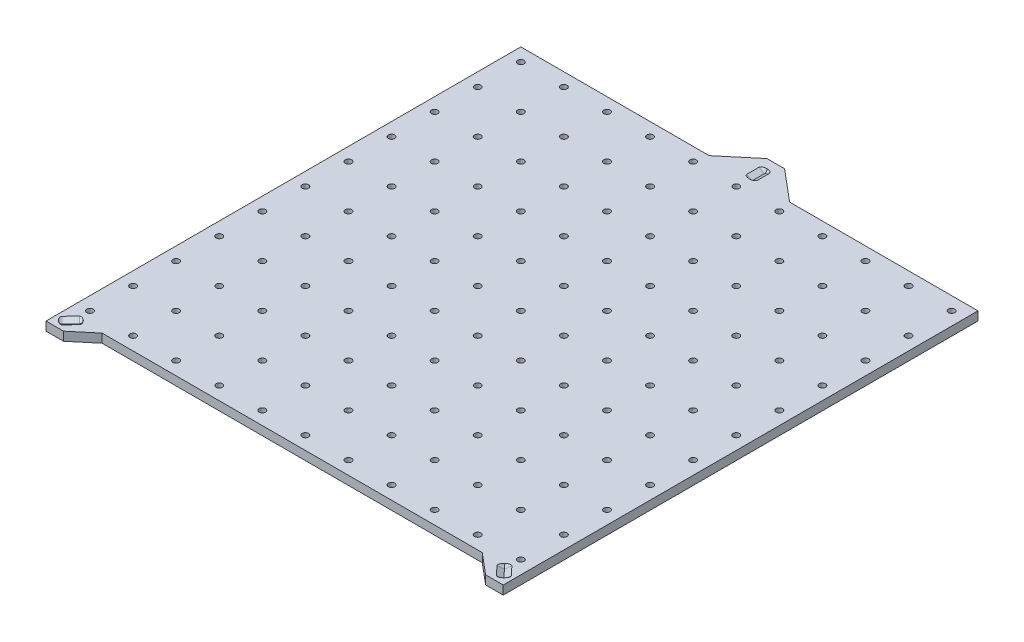
from build123d import *

# Parameters (mm, degrees)
BOSS_EXTRUDE1_DEPTH  = 10
CUT_EXTRUDE1_DEPTH   = 20
FILLET1_R            = 3
FILLET1_OF_MIRROR1_R = 3
CUT_EXTRUDE2_DEPTH   = 20
FILLET2_R            = 3
SKETCH7_R            = 6.25
CUT_EXTRUDE3_DEPTH   = 5.5
SKETCH8_R            = 3.6
CUT_EXTRUDE4_DEPTH   = 8.5


with BuildPart() as part:
    # Sketch1 → Boss-Extrude1 (new body)
    with BuildSketch(Plane(origin=(0, 0, 0), x_dir=(1, 0, 0), z_dir=(0, 1, 0))):
        Polygon((-260, -260), (-260, -280), (-240, -280), (-216.164928148, -260), (216.164928148, -260), (240, -280), (260, -280), (260, -260), (260, 260), (45.752607778, 260), (10, 290), (-10, 290), (-45.752607778, 260), (-260, 260), align=None)
    extrude(amount=BOSS_EXTRUDE1_DEPTH)

    # Sketch5 → Cut-Extrude1 (cut)
    with BuildSketch(Plane(origin=(-253.195489006, 0, 272.672065084), x_dir=(0, -1, 0), z_dir=(0.6804510993672804, 0, -0.7327934916262968))):
        Polygon((-10, 6), (-10, -6), (-6.535898385, 0), align=None)
    cut_extrude1 = extrude(amount=CUT_EXTRUDE1_DEPTH, mode=Mode.SUBTRACT)

    # Fillet1
    fillet1_edges = [part.edges().sort_by_distance(p)[0] for p in [
        (-241.784847494, 8.267949192, 255.974841953),
        (-237.388086544, 8.267949192, 260.057548549),
        (-250.997108531, 8.267949192, 274.713418382),
        (-255.393869481, 8.267949192, 270.630711786),
    ]]
    fillet(fillet1_edges, radius=FILLET1_R - 0.0001)  # a hair under: the kernel refuses the full size

    # Mirror1: Cut-Extrude1 across plane
    add(cut_extrude1.mirror(Plane(origin=(0, 0, 0), x_dir=(0, 0, 1), z_dir=(1, 0, 0))), mode=Mode.SUBTRACT)

    # Fillet1 of Mirror1
    fillet1_of_mirror1_edges = [part.edges().sort_by_distance(p)[0] for p in [
        (241.784847494, 8.267949192, 255.974841953),
        (237.388086544, 8.267949192, 260.057548549),
        (250.997108531, 8.267949192, 274.713418382),
        (255.393869481, 8.267949192, 270.630711786),
    ]]
    fillet(fillet1_of_mirror1_edges, radius=FILLET1_OF_MIRROR1_R - 0.0001)  # a hair under: the kernel refuses the full size

    # Sketch6 → Cut-Extrude2 (cut)
    with BuildSketch(Plane(origin=(0, 0, -280), x_dir=(-1, 0, 0), z_dir=(0, 0, -1))):
        Polygon((-6, 10), (6, 10), (0, 6.535898385), align=None)
    extrude(amount=-CUT_EXTRUDE2_DEPTH, mode=Mode.SUBTRACT)

    # Fillet2
    fillet2_edges = [part.edges().sort_by_distance(p)[0] for p in [
        (3, 8.267949192, -260),
        (-3, 8.267949192, -260),
        (3, 8.267949192, -280),
        (-3, 8.267949192, -280),
    ]]
    fillet(fillet2_edges, radius=FILLET2_R - 0.0001)  # a hair under: the kernel refuses the full size

    # Sketch7 → Cut-Extrude3 (cut)
    with BuildSketch(Plane.XZ):
        with Locations(Location((-246.390978013, 265.344130167, 0), (0, 0, 270))):
            Circle(SKETCH7_R)
        with Locations(Location((246.390978013, 265.344130167, 0), (0, 0, 270))):
            Circle(SKETCH7_R)
        with Locations(Location((0, -270, 0), (0, 0, 270))):
            Circle(SKETCH7_R)
    extrude(amount=-CUT_EXTRUDE3_DEPTH, mode=Mode.SUBTRACT)

    # Sketch8 → Cut-Extrude4 (cut)
    with BuildSketch(Plane(origin=(0, 10, 0), x_dir=(1, 0, 0), z_dir=(0, 1, 0))):
        with Locations(Location((-245, -245, 0), (0, 0, 270))):
            Circle(SKETCH8_R)
        with Locations(Location((-196, -245, 0), (0, 0, 270))):
            Circle(SKETCH8_R)
        with Locations(Location((-147, -245, 0), (0, 0, 270))):
            Circle(SKETCH8_R)
        with Locations(Location((-98, -245, 0), (0, 0, 270))):
            Circle(SKETCH8_R)
        with Locations(Location((-49, -245, 0), (0, 0, 270))):
            Circle(SKETCH8_R)
        with Locations(Location((0, -245, 0), (0, 0, 270))):
            Circle(SKETCH8_R)
        with Locations(Location((49, -245, 0), (0, 0, 270))):
            Circle(SKETCH8_R)
        with Locations(Location((98, -245, 0), (0, 0, 270))):
            Circle(SKETCH8_R)
        with Locations(Location((147, -245, 0), (0, 0, 270))):
            Circle(SKETCH8_R)
        with Locations(Location((196, -245, 0), (0, 0, 270))):
            Circle(SKETCH8_R)
        with Locations(Location((245, -245, 0), (0, 0, 270))):
            Circle(SKETCH8_R)
        with Locations(Location((-196, -196, 0), (0, 0, 270))):
            Circle(SKETCH8_R)
        with Locations(Location((-147, -196, 0), (0, 0, 270))):
            Circle(SKETCH8_R)
        with Locations(Location((-98, -196, 0), (0, 0, 270))):
            Circle(SKETCH8_R)
        with Locations(Location((-49, -196, 0), (0, 0, 270))):
            Circle(SKETCH8_R)
        with Locations(Location((0, -196, 0), (0, 0, 270))):
            Circle(SKETCH8_R)
        with Locations(Location((49, -196, 0), (0, 0, 270))):
            Circle(SKETCH8_R)
        with Locations(Location((98, -196, 0), (0, 0, 270))):
            Circle(SKETCH8_R)
        with Locations(Location((147, -196, 0), (0, 0, 270))):
            Circle(SKETCH8_R)
        with Locations(Location((196, -196, 0), (0, 0, 270))):
            Circle(SKETCH8_R)
        with Locations(Location((245, -196, 0), (0, 0, 270))):
            Circle(SKETCH8_R)
        with Locations(Location((-196, -147, 0), (0, 0, 270))):
            Circle(SKETCH8_R)
        with Locations(Location((-147, -147, 0), (0, 0, 270))):
            Circle(SKETCH8_R)
        with Locations(Location((-98, -147, 0), (0, 0, 270))):
            Circle(SKETCH8_R)
        with Locations(Location((-49, -147, 0), (0, 0, 270))):
            Circle(SKETCH8_R)
        with Locations(Location((0, -147, 0), (0, 0, 270))):
            Circle(SKETCH8_R)
        with Locations(Location((49, -147, 0), (0, 0, 270))):
            Circle(SKETCH8_R)
        with Locations(Location((98, -147, 0), (0, 0, 270))):
            Circle(SKETCH8_R)
        with Locations(Location((147, -147, 0), (0, 0, 270))):
            Circle(SKETCH8_R)
        with Locations(Location((196, -147, 0), (0, 0, 270))):
            Circle(SKETCH8_R)
        with Locations(Location((245, -147, 0), (0, 0, 270))):
            Circle(SKETCH8_R)
        with Locations(Location((-196, -98, 0), (0, 0, 270))):
            Circle(SKETCH8_R)
        with Locations(Location((-147, -98, 0), (0, 0, 270))):
            Circle(SKETCH8_R)
        with Locations(Location((-98, -98, 0), (0, 0, 270))):
            Circle(SKETCH8_R)
        with Locations(Location((-49, -98, 0), (0, 0, 270))):
            Circle(SKETCH8_R)
        with Locations(Location((0, -98, 0), (0, 0, 270))):
            Circle(SKETCH8_R)
        with Locations(Location((49, -98, 0), (0, 0, 270))):
            Circle(SKETCH8_R)
        with Locations(Location((98, -98, 0), (0, 0, 270))):
            Circle(SKETCH8_R)
        with Locations(Location((147, -98, 0), (0, 0, 270))):
            Circle(SKETCH8_R)
        with Locations(Location((196, -98, 0), (0, 0, 270))):
            Circle(SKETCH8_R)
        with Locations(Location((245, -98, 0), (0, 0, 270))):
            Circle(SKETCH8_R)
        with Locations(Location((-196, -49, 0), (0, 0, 270))):
            Circle(SKETCH8_R)
        with Locations(Location((-147, -49, 0), (0, 0, 270))):
            Circle(SKETCH8_R)
        with Locations(Location((-98, -49, 0), (0, 0, 270))):
            Circle(SKETCH8_R)
        with Locations(Location((-49, -49, 0), (0, 0, 270))):
            Circle(SKETCH8_R)
        with Locations(Location((0, -49, 0), (0, 0, 270))):
            Circle(SKETCH8_R)
        with Locations(Location((49, -49, 0), (0, 0, 270))):
            Circle(SKETCH8_R)
        with Locations(Location((98, -49, 0), (0, 0, 270))):
            Circle(SKETCH8_R)
        with Locations(Location((147, -49, 0), (0, 0, 270))):
            Circle(SKETCH8_R)
        with Locations(Location((196, -49, 0), (0, 0, 270))):
            Circle(SKETCH8_R)
        with Locations(Location((245, -49, 0), (0, 0, 270))):
            Circle(SKETCH8_R)
        with Locations(Location((-196, 0, 0), (0, 0, 270))):
            Circle(SKETCH8_R)
        with Locations(Location((-147, 0, 0), (0, 0, 270))):
            Circle(SKETCH8_R)
        with Locations(Location((-98, 0, 0), (0, 0, 270))):
            Circle(SKETCH8_R)
        with Locations(Location((-49, 0, 0), (0, 0, 270))):
            Circle(SKETCH8_R)
        with Locations(Location((0, 0, 0), (0, 0, 270))):
            Circle(SKETCH8_R)
        with Locations(Location((49, 0, 0), (0, 0, 270))):
            Circle(SKETCH8_R)
        with Locations(Location((98, 0, 0), (0, 0, 270))):
            Circle(SKETCH8_R)
        with Locations(Location((147, 0, 0), (0, 0, 270))):
            Circle(SKETCH8_R)
        with Locations(Location((196, 0, 0), (0, 0, 270))):
            Circle(SKETCH8_R)
        with Locations(Location((245, 0, 0), (0, 0, 270))):
            Circle(SKETCH8_R)
        with Locations(Location((-196, 49, 0), (0, 0, 270))):
            Circle(SKETCH8_R)
        with Locations(Location((-147, 49, 0), (0, 0, 270))):
            Circle(SKETCH8_R)
        with Locations(Location((-98, 49, 0), (0, 0, 270))):
            Circle(SKETCH8_R)
        with Locations(Location((-49, 49, 0), (0, 0, 270))):
            Circle(SKETCH8_R)
        with Locations(Location((0, 49, 0), (0, 0, 270))):
            Circle(SKETCH8_R)
        with Locations(Location((49, 49, 0), (0, 0, 270))):
            Circle(SKETCH8_R)
        with Locations(Location((98, 49, 0), (0, 0, 270))):
            Circle(SKETCH8_R)
        with Locations(Location((147, 49, 0), (0, 0, 270))):
            Circle(SKETCH8_R)
        with Locations(Location((196, 49, 0), (0, 0, 270))):
            Circle(SKETCH8_R)
        with Locations(Location((245, 49, 0), (0, 0, 270))):
            Circle(SKETCH8_R)
        with Locations(Location((-196, 98, 0), (0, 0, 270))):
            Circle(SKETCH8_R)
        with Locations(Location((-147, 98, 0), (0, 0, 270))):
            Circle(SKETCH8_R)
        with Locations(Location((-98, 98, 0), (0, 0, 270))):
            Circle(SKETCH8_R)
        with Locations(Location((-49, 98, 0), (0, 0, 270))):
            Circle(SKETCH8_R)
        with Locations(Location((0, 98, 0), (0, 0, 270))):
            Circle(SKETCH8_R)
        with Locations(Location((49, 98, 0), (0, 0, 270))):
            Circle(SKETCH8_R)
        with Locations(Location((98, 98, 0), (0, 0, 270))):
            Circle(SKETCH8_R)
        with Locations(Location((147, 98, 0), (0, 0, 270))):
            Circle(SKETCH8_R)
        with Locations(Location((196, 98, 0), (0, 0, 270))):
            Circle(SKETCH8_R)
        with Locations(Location((245, 98, 0), (0, 0, 270))):
            Circle(SKETCH8_R)
        with Locations(Location((-196, 147, 0), (0, 0, 270))):
            Circle(SKETCH8_R)
        with Locations(Location((-147, 147, 0), (0, 0, 270))):
            Circle(SKETCH8_R)
        with Locations(Location((-98, 147, 0), (0, 0, 270))):
            Circle(SKETCH8_R)
        with Locations(Location((-49, 147, 0), (0, 0, 270))):
            Circle(SKETCH8_R)
        with Locations(Location((0, 147, 0), (0, 0, 270))):
            Circle(SKETCH8_R)
        with Locations(Location((49, 147, 0), (0, 0, 270))):
            Circle(SKETCH8_R)
        with Locations(Location((98, 147, 0), (0, 0, 270))):
            Circle(SKETCH8_R)
        with Locations(Location((147, 147, 0), (0, 0, 270))):
            Circle(SKETCH8_R)
        with Locations(Location((196, 147, 0), (0, 0, 270))):
            Circle(SKETCH8_R)
        with Locations(Location((245, 147, 0), (0, 0, 270))):
            Circle(SKETCH8_R)
        with Locations(Location((-196, 196, 0), (0, 0, 270))):
            Circle(SKETCH8_R)
        with Locations(Location((-147, 196, 0), (0, 0, 270))):
            Circle(SKETCH8_R)
        with Locations(Location((-98, 196, 0), (0, 0, 270))):
            Circle(SKETCH8_R)
        with Locations(Location((-49, 196, 0), (0, 0, 270))):
            Circle(SKETCH8_R)
        with Locations(Location((0, 196, 0), (0, 0, 270))):
            Circle(SKETCH8_R)
        with Locations(Location((49, 196, 0), (0, 0, 270))):
            Circle(SKETCH8_R)
        with Locations(Location((98, 196, 0), (0, 0, 270))):
            Circle(SKETCH8_R)
        with Locations(Location((147, 196, 0), (0, 0, 270))):
            Circle(SKETCH8_R)
        with Locations(Location((196, 196, 0), (0, 0, 270))):
            Circle(SKETCH8_R)
        with Locations(Location((245, 196, 0), (0, 0, 270))):
            Circle(SKETCH8_R)
        with Locations(Location((-196, 245, 0), (0, 0, 270))):
            Circle(SKETCH8_R)
        with Locations(Location((-147, 245, 0), (0, 0, 270))):
            Circle(SKETCH8_R)
        with Locations(Location((-98, 245, 0), (0, 0, 270))):
            Circle(SKETCH8_R)
        with Locations(Location((-49, 245, 0), (0, 0, 270))):
            Circle(SKETCH8_R)
        with Locations(Location((0, 245, 0), (0, 0, 270))):
            Circle(SKETCH8_R)
        with Locations(Location((49, 245, 0), (0, 0, 270))):
            Circle(SKETCH8_R)
        with Locations(Location((98, 245, 0), (0, 0, 270))):
            Circle(SKETCH8_R)
        with Locations(Location((147, 245, 0), (0, 0, 270))):
            Circle(SKETCH8_R)
        with Locations(Location((196, 245, 0), (0, 0, 270))):
            Circle(SKETCH8_R)
        with Locations(Location((245, 245, 0), (0, 0, 270))):
            Circle(SKETCH8_R)
        with Locations(Location((-245, -196, 0), (0, 0, 270))):
            Circle(SKETCH8_R)
        with Locations(Location((-245, -147, 0), (0, 0, 270))):
            Circle(SKETCH8_R)
        with Locations(Location((-245, -98, 0), (0, 0, 270))):
            Circle(SKETCH8_R)
        with Locations(Location((-245, -49, 0), (0, 0, 270))):
            Circle(SKETCH8_R)
        with Locations(Location((-245, 0, 0), (0, 0, 270))):
            Circle(SKETCH8_R)
        with Locations(Location((-245, 49, 0), (0, 0, 270))):
            Circle(SKETCH8_R)
        with Locations(Location((-245, 98, 0), (0, 0, 270))):
            Circle(SKETCH8_R)
        with Locations(Location((-245, 147, 0), (0, 0, 270))):
            Circle(SKETCH8_R)
        with Locations(Location((-245, 196, 0), (0, 0, 270))):
            Circle(SKETCH8_R)
        with Locations(Location((-245, 245, 0), (0, 0, 270))):
            Circle(SKETCH8_R)
    extrude(amount=-CUT_EXTRUDE4_DEPTH, mode=Mode.SUBTRACT)


solid = part.part
